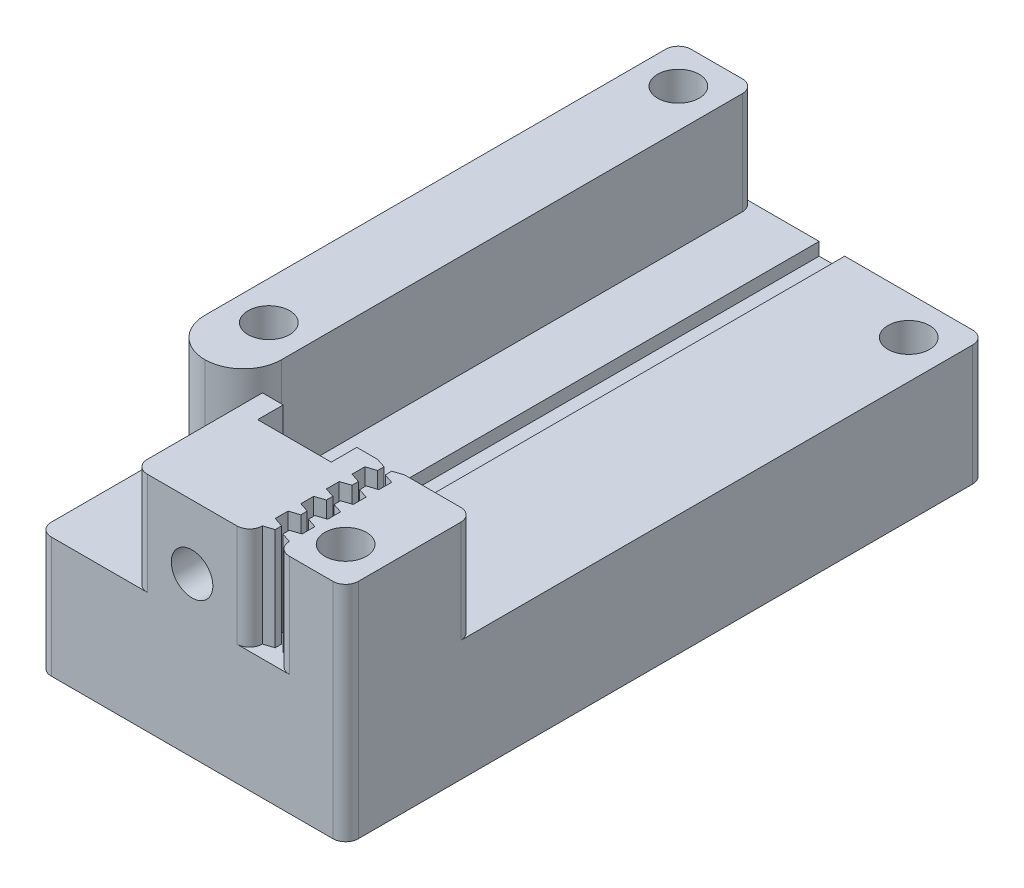
from build123d import *

# Parameters (mm, degrees)
SKETCH1_W           = 24
SKETCH1_H           = 50
BOSS_EXTRUDE1_DEPTH = 9.42
SKETCH2_W           = 6
SKETCH2_H           = 40
SKETCH2_W_2         = 9
SKETCH2_H_2         = 10
SKETCH2_W_3         = 5.4
BOSS_EXTRUDE2_DEPTH = 8
FILLET1_R           = 3
SKETCH4_R           = 1.625
CUT_EXTRUDE2_DEPTH  = 46.248827609
CUT_EXTRUDE3_DEPTH  = 2
SKETCH6_W           = 2
SKETCH6_H           = 40
CUT_EXTRUDE4_DEPTH  = 1
SKETCH7_R           = 1.125
CUT_EXTRUDE5_DEPTH  = 12
SKETCH9_R           = 1.625
CUT_EXTRUDE6_DEPTH  = 33.748380113
FILLET2_R           = 1
BOSS_EXTRUDE3_DEPTH = 8
LPATTERN1_COUNT     = 5
LPATTERN1_PITCH     = 2


with BuildPart() as part:
    # Sketch1 → Boss-Extrude1 (new body)
    with BuildSketch(Plane(origin=(0, 0, 0), x_dir=(1, 0, 0), z_dir=(0, 1, 0))):
        Rectangle(SKETCH1_W, SKETCH1_H)
    extrude(amount=BOSS_EXTRUDE1_DEPTH)

    # Sketch2 → Boss-Extrude2 (add)
    with BuildSketch(Plane(origin=(0, 9.42, 0), x_dir=(1, 0, 0), z_dir=(0, 1, 0))):
        with Locations((-9, 5)):
            Rectangle(SKETCH2_W, SKETCH2_H)
        with Locations((0, -20)):
            Rectangle(SKETCH2_W_2, SKETCH2_H_2)
        with Locations((9.3, -20)):
            Rectangle(SKETCH2_W_3, SKETCH2_H_2)
    extrude(amount=BOSS_EXTRUDE2_DEPTH)

    # Fillet1
    fillet1_edges = [part.edges().sort_by_distance(p)[0] for p in [
        (-12, 13.42, 15),
        (-6, 13.42, 15),
    ]]
    fillet(fillet1_edges, radius=FILLET1_R - 0.0001)  # a hair under: the kernel refuses the full size

    # Sketch4 → Cut-Extrude2 (cut, through all)
    with BuildSketch(Plane(origin=(0, 0, 15), x_dir=(-1, 0, 0), z_dir=(0, 0, -1))):
        with Locations((0, 12.42)):
            Circle(SKETCH4_R)
    extrude(amount=-CUT_EXTRUDE2_DEPTH, mode=Mode.SUBTRACT)

    # Sketch5 → Cut-Extrude3 (cut)
    with BuildSketch(Plane(origin=(0, 0, 15), x_dir=(-1, 0, 0), z_dir=(0, 0, -1))):
        Polygon((-2.875, 14.079882024), (-2.875, 17.42), (2.875, 17.42), (2.875, 14.079882024), (2.875, 10.760117976), (0, 9.100235952), (-2.875, 10.760117976), align=None)
    extrude(amount=-CUT_EXTRUDE3_DEPTH, mode=Mode.SUBTRACT)

    # Sketch6 → Cut-Extrude4 (cut)
    with BuildSketch(Plane(origin=(0, 9.42, 0), x_dir=(1, 0, 0), z_dir=(0, 1, 0))):
        with Locations((0, 5)):
            Rectangle(SKETCH6_W, SKETCH6_H)
    extrude(amount=-CUT_EXTRUDE4_DEPTH, mode=Mode.SUBTRACT)

    # Sketch7 → Cut-Extrude5 (cut)
    with BuildSketch(Plane.ZY.offset(12)):
        with Locations((20, 4.93)):
            Circle(SKETCH7_R)
    extrude(amount=-CUT_EXTRUDE5_DEPTH, mode=Mode.SUBTRACT)

    # Sketch9 → Cut-Extrude6 (cut, through all)
    with BuildSketch(Plane.XZ):
        with Locations(Location((9, 22, 0), (0, 0, 270))):
            Circle(SKETCH9_R)
        with Locations(Location((9, -22, 0), (0, 0, 270))):
            Circle(SKETCH9_R)
        with Locations(Location((-9, -22, 0), (0, 0, 270))):
            Circle(SKETCH9_R)
        with Locations(Location((-9, 10, 0), (0, 0, 270))):
            Circle(SKETCH9_R)
    extrude(amount=-CUT_EXTRUDE6_DEPTH, mode=Mode.SUBTRACT)

    # Fillet2
    fillet2_edges = [part.edges().sort_by_distance(p)[0] for p in [
        (-6, 13.42, -25),
        (-4.5, 13.42, 25),
        (4.5, 13.42, 25),
        (12, 13.42, 15),
        (6.6, 13.42, 25),
        (-12, 8.71, -25),
        (12, 4.71, -25),
        (12, 8.71, 25),
        (-12, 4.71, 25),
    ]]
    fillet(fillet2_edges, radius=FILLET2_R)

    # Sketch10 → Boss-Extrude3 (add)
    with BuildSketch(Plane(origin=(0, 9.42, 0), x_dir=(1, 0, 0), z_dir=(0, 1, 0))):
        Polygon((4.5, -24), (4.5, -23), (5.25, -23.25), (5.25, -23.75), align=None)
        Polygon((6.6, -24), (6.6, -23), (5.85, -23.25), (5.85, -23.75), align=None)
    boss_extrude3 = extrude(amount=BOSS_EXTRUDE3_DEPTH)

    # LPattern1: Boss-Extrude3 ×5
    with Locations(*[(0, 0, -i * LPATTERN1_PITCH) for i in range(1, LPATTERN1_COUNT)]):
        add(boss_extrude3)


solid = part.part
